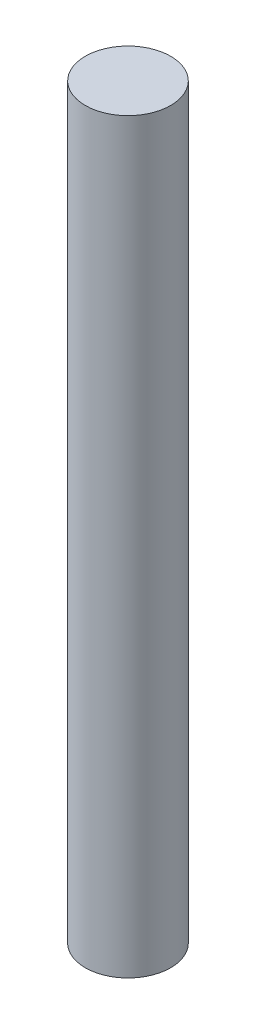
from build123d import *

# Parameters (mm, degrees)
CROQUIS1_R              = 4
SALIENTE_EXTRUIR1_DEPTH = 70


with BuildPart() as part:
    # Croquis1 → Saliente-Extruir1 (new body)
    with BuildSketch(Plane(origin=(0, 0, 0), x_dir=(1, 0, 0), z_dir=(0, 1, 0))):
        Circle(CROQUIS1_R)
    extrude(amount=SALIENTE_EXTRUIR1_DEPTH)


solid = part.part
